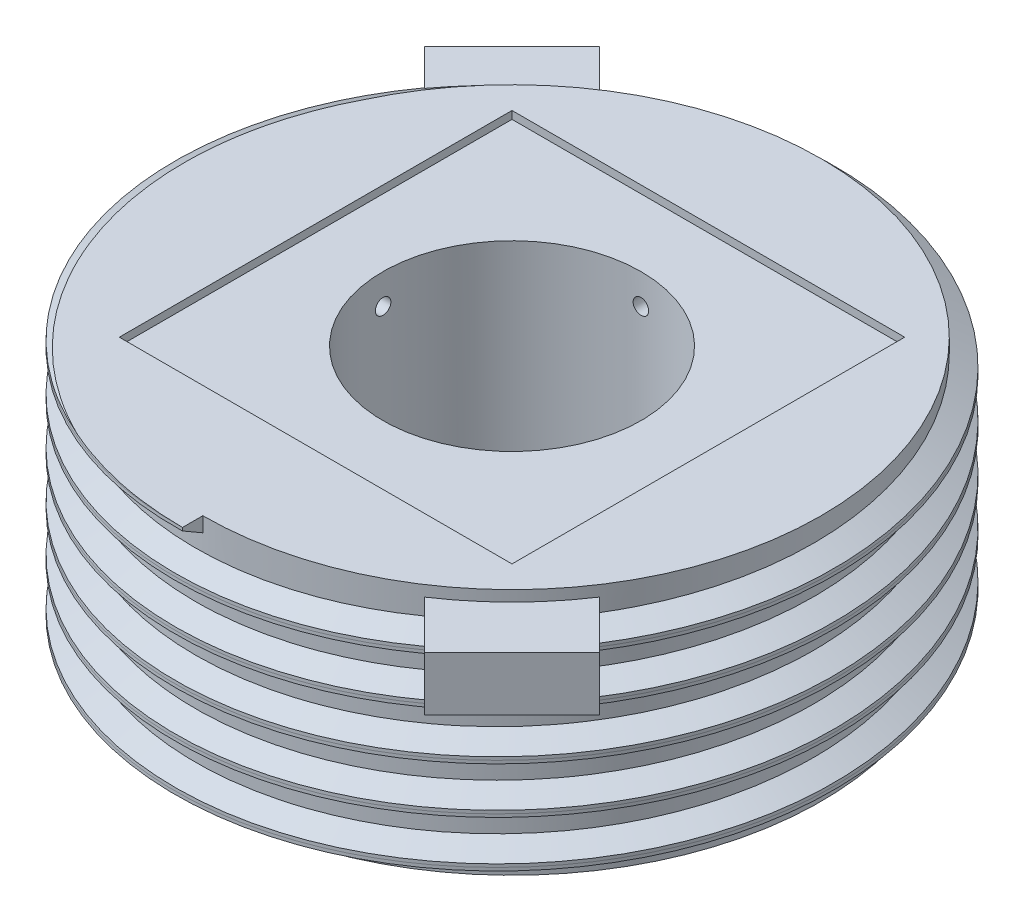
from build123d import *

# Parameters (mm, degrees)
INNERCIRCLE_R            = 20
INNERCIRCLE_R_2          = 7.35
CIRCLE_DEPTH             = 16
SWEEP1_PITCH             = 3
SKETCH16_R               = 0.5
CUT_EXTRUDE2_DEPTH       = 35.636767763
SKETCH15_R               = 0.5
CUT_EXTRUDE3_DEPTH       = 10
BOSS_EXTRUDE1_DEPTH      = 24
BOSS_EXTRUDE1_DEPTH_BACK = 24
SKETCH17_W               = 3.5
SKETCH17_H               = 8
SKETCH18_R               = 8.35
CUT_EXTRUDE4_DEPTH       = 35.636767763
CUT_EXTRUDE5_DEPTH       = 35.636767763
CUT_EXTRUDE5_DEPTH_BACK  = 35.636767763
SKETCH19_W               = 40.52336504
SKETCH19_H               = 2
CUT_EXTRUDE6_DEPTH       = 35.636767763
CUT_EXTRUDE6_DEPTH_BACK  = 35.636767763
SKETCH20_W               = 41.312630598
SKETCH20_H               = 2.240310333
SKETCH21_R               = 14
SKETCH21_R_2             = 12.3
CUT_EXTRUDE7_DEPTH       = 0.7
SKETCH22_W               = 25.4
SKETCH22_H               = 25.4
CUT_EXTRUDE8_DEPTH       = 0.5
SKETCH23_R               = 1.6
CUT_EXTRUDE9_DEPTH       = 42.118232838


with BuildPart() as part:
    # innerCircle → Circle (new body)
    with BuildSketch(Plane(origin=(0, 0, 0), x_dir=(1, 0, 0), z_dir=(0, 1, 0))):
        with Locations(Location((0, 0, 0), (0, 0, 270))):
            Circle(INNERCIRCLE_R)
        with Locations(Location((0, 0, 0), (0, 0, 270))):
            Circle(INNERCIRCLE_R_2, mode=Mode.SUBTRACT)
    extrude(amount=CIRCLE_DEPTH)

    # Sweep1: the profile of Sketch14 screwed along a right-hand helix of 5.333333 turns, 10 arcs to a turn; built about Z, then put on its axis
    sweep1_z = Axis((0, 0, 0), (0, 0, 1))
    sweep1_corners = [(21.312630598, 0, 0), (21.312630598, 0, -0.2), (19.812630598, 0, -1.066025404), (19.812630598, 0, 1.066025404), (21.312630598, 0, 0.2)]
    with BuildLine(mode=Mode.PRIVATE) as sweep1_profile:
        Line(sweep1_corners[0], sweep1_corners[1])
        Line(sweep1_corners[1], sweep1_corners[2])
        Line(sweep1_corners[2], sweep1_corners[3])
        Line(sweep1_corners[3], sweep1_corners[4])
        Line(sweep1_corners[4], sweep1_corners[0])
    sweep1_cap = Face(sweep1_profile.wire())
    sweep1_turn_angles = [0, 18, 36, 54, 72, 90, 108, 126, 144, 162, 180, 198, 216, 234, 252, 270, 288, 306, 324, 342, 360]
    sweep1_turn_weights = [1, 0.9510565162951535, 1, 0.9510565162951535, 1, 0.9510565162951535, 1, 0.9510565162951535, 1, 0.9510565162951535, 1, 0.9510565162951535, 1, 0.9510565162951535, 1, 0.9510565162951535, 1, 0.9510565162951535, 1, 0.9510565162951535, 1]
    sweep1_turn_rails = [Edge.make_bspline([Vector(p[0], p[1], 0).rotate(sweep1_z, sweep1_turn_angles[k]) / sweep1_turn_weights[k] + Vector(0, 0, p[2] + SWEEP1_PITCH * sweep1_turn_angles[k] / 360) for k in range(21)], [0, 0, 0, 1, 1, 2, 2, 3, 3, 4, 4, 5, 5, 6, 6, 7, 7, 8, 8, 9, 9, 10, 10, 10], 2, sweep1_turn_weights) for p in sweep1_corners]
    sweep1_turn_sides = [Face.make_surface_from_curves(sweep1_turn_rails[p[0]], sweep1_turn_rails[p[1]]) for p in [(0, 1), (1, 2), (2, 3), (3, 4), (4, 0)]]
    sweep1_last_angles = [1800, 1818, 1836, 1854, 1872, 1890, 1908, 1914, 1920]
    sweep1_last_weights = [1, 0.9510565162951535, 1, 0.9510565162951535, 1, 0.9510565162951535, 1, 0.9945218953682723, 1]
    sweep1_last_rails = [Edge.make_bspline([Vector(p[0], p[1], 0).rotate(sweep1_z, sweep1_last_angles[k]) / sweep1_last_weights[k] + Vector(0, 0, p[2] + SWEEP1_PITCH * sweep1_last_angles[k] / 360) for k in range(9)], [0, 0, 0, 1, 1, 2, 2, 3, 3, 4, 4, 4], 2, sweep1_last_weights) for p in sweep1_corners]
    sweep1_last_sides = [Face.make_surface_from_curves(sweep1_last_rails[p[0]], sweep1_last_rails[p[1]]) for p in [(0, 1), (1, 2), (2, 3), (3, 4), (4, 0)]]
    sweep1 = Plane(origin=(0, 16, 0), x_dir=(0, 0, 1), z_dir=(0, -1, 0)) * Solid(Shell([*[p.moved(Location((0, 0, SWEEP1_PITCH * i))) for i in range(5) for p in sweep1_turn_sides], *sweep1_last_sides, sweep1_cap, sweep1_cap.rotate(sweep1_z, 1920).moved(Location((0, 0, SWEEP1_PITCH * 1920 / 360)))]))
    add(sweep1)

    # Sketch16 → Cut-Extrude2 (cut, through all)
    with BuildSketch(Plane.XY):
        with Locations(Location((0, 13.54848753, 0), (0, 0, 357.946551449))):
            Circle(SKETCH16_R)
    extrude(amount=-CUT_EXTRUDE2_DEPTH, mode=Mode.SUBTRACT)

    # Sketch15 → Cut-Extrude3 (cut)
    with BuildSketch(Plane(origin=(0, 0, 0), x_dir=(0, 0, -1), z_dir=(1, 0, 0))):
        with Locations((0, 13.54848753)):
            Circle(SKETCH15_R)
    extrude(amount=-CUT_EXTRUDE3_DEPTH, mode=Mode.SUBTRACT)

    # Sketch17 → Boss-Extrude1 (add, two sides: drawn at the far end of the back side and taken through both)
    with BuildSketch(Plane(origin=(0, 0, 0), x_dir=(0, -1, 0), z_dir=(0.7071067811865464, 0, 0.7071067811865488)).offset(-BOSS_EXTRUDE1_DEPTH_BACK)):
        with Locations((-13.54848753, 0)):
            Rectangle(SKETCH17_W, SKETCH17_H)
    extrude(amount=BOSS_EXTRUDE1_DEPTH + BOSS_EXTRUDE1_DEPTH_BACK)

    # Sketch18 → Cut-Extrude4 (cut, through all)
    with BuildSketch(Plane(origin=(0, 0, 0), x_dir=(1, 0, 0), z_dir=(0, 1, 0))):
        with Locations(Location((0, 0, 0), (0, 0, 270))):
            Circle(SKETCH18_R)
    extrude(amount=CUT_EXTRUDE4_DEPTH, mode=Mode.SUBTRACT)

    # Sketch19 → Cut-Extrude5 (cut, two sides: drawn at the far end of the back side and taken through both)
    with BuildSketch(Plane(origin=(0, 0, 0), x_dir=(0, 0, -1), z_dir=(1, 0, 0)).offset(-CUT_EXTRUDE5_DEPTH_BACK)):
        with Locations((0.342827848, -1)):
            Rectangle(SKETCH19_W, SKETCH19_H)
    extrude(amount=CUT_EXTRUDE5_DEPTH + CUT_EXTRUDE5_DEPTH_BACK, mode=Mode.SUBTRACT)

    # Sketch20 → Cut-Extrude6 (cut, two sides: drawn at the far end of the back side and taken through both)
    with BuildSketch(Plane(origin=(0, 0, 0), x_dir=(0, 0, -1), z_dir=(1, 0, 0)).offset(-CUT_EXTRUDE6_DEPTH_BACK)):
        with Locations((-0.656315299, 17.120155166)):
            Rectangle(SKETCH20_W, SKETCH20_H)
    extrude(amount=CUT_EXTRUDE6_DEPTH + CUT_EXTRUDE6_DEPTH_BACK, mode=Mode.SUBTRACT)

    # Sketch21 → Cut-Extrude7 (cut)
    with BuildSketch(Plane.XZ):
        with Locations(Location((0, 0, 0), (0, 0, 270))):
            Circle(SKETCH21_R)
        with Locations(Location((0, 0, 0), (0, 0, 270))):
            Circle(SKETCH21_R_2, mode=Mode.SUBTRACT)
    extrude(amount=-CUT_EXTRUDE7_DEPTH, mode=Mode.SUBTRACT)

    # Sketch22 → Cut-Extrude8 (cut)
    with BuildSketch(Plane(origin=(0, 16, 0), x_dir=(1, 0, 0), z_dir=(0, 1, 0))):
        Rectangle(SKETCH22_W, SKETCH22_H)
    extrude(amount=-CUT_EXTRUDE8_DEPTH, mode=Mode.SUBTRACT)

    # Sketch23 → Cut-Extrude9 (cut, through all)
    with BuildSketch(Plane(origin=(-10, 0, 0), x_dir=(0, 0, -1), z_dir=(1, 0, 0))):
        with Locations((0, 13.54848753)):
            Circle(SKETCH23_R)
    extrude(amount=-CUT_EXTRUDE9_DEPTH, mode=Mode.SUBTRACT)


solid = part.part
